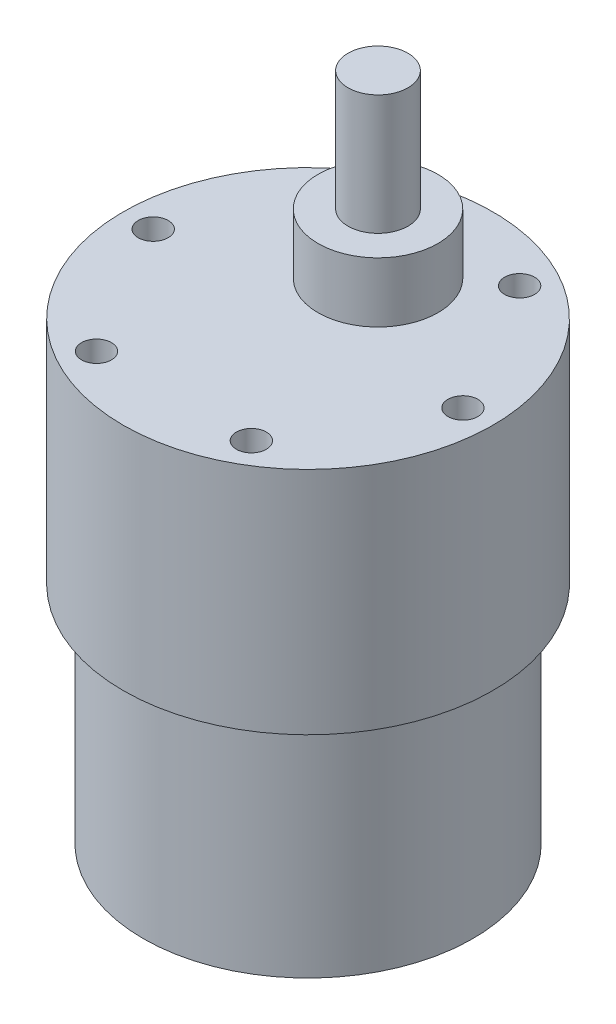
from build123d import *

# Parameters (mm, degrees)
SKETCH_1_R          = 18.5
EXTRUDE_1_DEPTH     = 23
SKETCH_3_R          = 16.5
EXTRUDE_2_DEPTH     = 22.5
SKETCH_4_R          = 1.5
CUT_EXTRUDE_1_DEPTH = 15
SKETCH_5_R          = 6
EXTRUDE_3_DEPTH     = 6
SKETCH_6_R          = 3
EXTRUDE_4_DEPTH     = 12
SKETCH_7_R          = 7
EXTRUDE_5_DEPTH     = 6.2


with BuildPart() as part:
    # 草图1 → 凸台-拉伸1 (new body)
    with BuildSketch(Plane(origin=(0, 0, 0), x_dir=(1, 0, 0), z_dir=(0, 1, 0))):
        Circle(SKETCH_1_R)
    extrude(amount=-EXTRUDE_1_DEPTH)

    # 草图3 → 凸台-拉伸2 (add)
    with BuildSketch(Plane.XZ.offset(23)):
        Circle(SKETCH_3_R)
    extrude(amount=EXTRUDE_2_DEPTH)

    # 草图4 → 切除-拉伸1 (cut)
    with BuildSketch(Plane(origin=(0, 0, 0), x_dir=(1, 0, 0), z_dir=(0, 1, 0))):
        with Locations((7.75, 13.423393759)):
            Circle(SKETCH_4_R)
        with Locations((15.5, 0)):
            Circle(SKETCH_4_R)
        with Locations((7.75, -13.423393759)):
            Circle(SKETCH_4_R)
        with Locations((-7.75, -13.423393759)):
            Circle(SKETCH_4_R)
        with Locations((-15.5, 0)):
            Circle(SKETCH_4_R)
        with Locations((-7.75, 13.423393759)):
            Circle(SKETCH_4_R)
    extrude(amount=-CUT_EXTRUDE_1_DEPTH, mode=Mode.SUBTRACT)

    # 草图5 → 凸台-拉伸3 (add)
    with BuildSketch(Plane(origin=(0, 0, 0), x_dir=(1, 0, 0), z_dir=(0, 1, 0))):
        with Locations((0, 7)):
            Circle(SKETCH_5_R)
    extrude(amount=EXTRUDE_3_DEPTH)

    # 草图6 → 凸台-拉伸4 (add)
    with BuildSketch(Plane(origin=(0, 6, 0), x_dir=(1, 0, 0), z_dir=(0, 1, 0))):
        with Locations((0, 7)):
            Circle(SKETCH_6_R)
    extrude(amount=EXTRUDE_4_DEPTH)

    # 草图7 → 凸台-拉伸5 (add)
    with BuildSketch(Plane.XZ.offset(45.5)):
        Circle(SKETCH_7_R)
    extrude(amount=EXTRUDE_5_DEPTH)


solid = part.part
